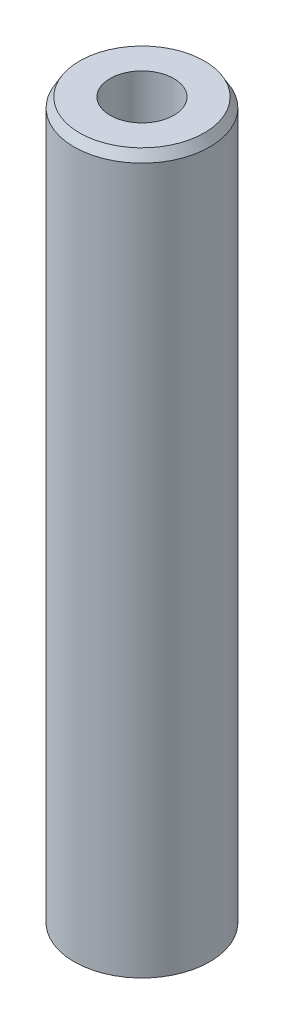
from build123d import *
from OCP.BRepFilletAPI import BRepFilletAPI_MakeChamfer

# Parameters (mm, degrees)
SKETCH1_R           = 20
BOSS_EXTRUDE1_DEPTH = 212.457654585
SKETCH2_R           = 9.403613151
CUT_EXTRUDE1_DEPTH  = 215.332113767
CHAMFER1_SIZE       = 2.787613746
CHAMFER1_SIZE2      = 1.609429547


with BuildPart() as part:
    # Sketch1 → Boss-Extrude1 (new body)
    with BuildSketch(Plane(origin=(0, 0, 0), x_dir=(1, 0, 0), z_dir=(0, 1, 0))):
        Circle(SKETCH1_R)
    extrude(amount=BOSS_EXTRUDE1_DEPTH)

    # Sketch2 → Cut-Extrude1 (cut, through all)
    with BuildSketch(Plane(origin=(0, 0, 0), x_dir=(1, 0, 0), z_dir=(0, 1, 0))):
        Circle(SKETCH2_R)
    extrude(amount=CUT_EXTRUDE1_DEPTH, mode=Mode.SUBTRACT)

    # Chamfer1: one chamfer whose edges measure the first distance from different faces: ONE call of the kernel's chamfer builder (chamfer() names one face for all edges)
    chamfer1_edges_1 = [part.edges().sort_by_distance(p)[0] for p in [
        (-20, 212.457654585, 0),
    ]]
    chamfer1_side_1 = [part.faces().sort_by_distance(p)[0] for p in [
        (-20, 106.228827293, 0),
    ]]
    chamfer1_edges_2 = [part.edges().sort_by_distance(p)[0] for p in [
        (-20, 0, 0),
    ]]
    chamfer1_side_2 = [part.faces().sort_by_distance(p)[0] for p in [
        (-19.434314575, 0, 0),
    ]]
    chamfer1 = BRepFilletAPI_MakeChamfer(part.part.solid().wrapped)
    for e in chamfer1_edges_1:
        chamfer1.Add(CHAMFER1_SIZE, CHAMFER1_SIZE2, e.wrapped, chamfer1_side_1[0].wrapped)  # the first distance lies on this face
    for e in chamfer1_edges_2:
        chamfer1.Add(CHAMFER1_SIZE, CHAMFER1_SIZE2, e.wrapped, chamfer1_side_2[0].wrapped)  # the first distance lies on this face
    add(Compound.cast(chamfer1.Shape()), mode=Mode.REPLACE)


solid = part.part
